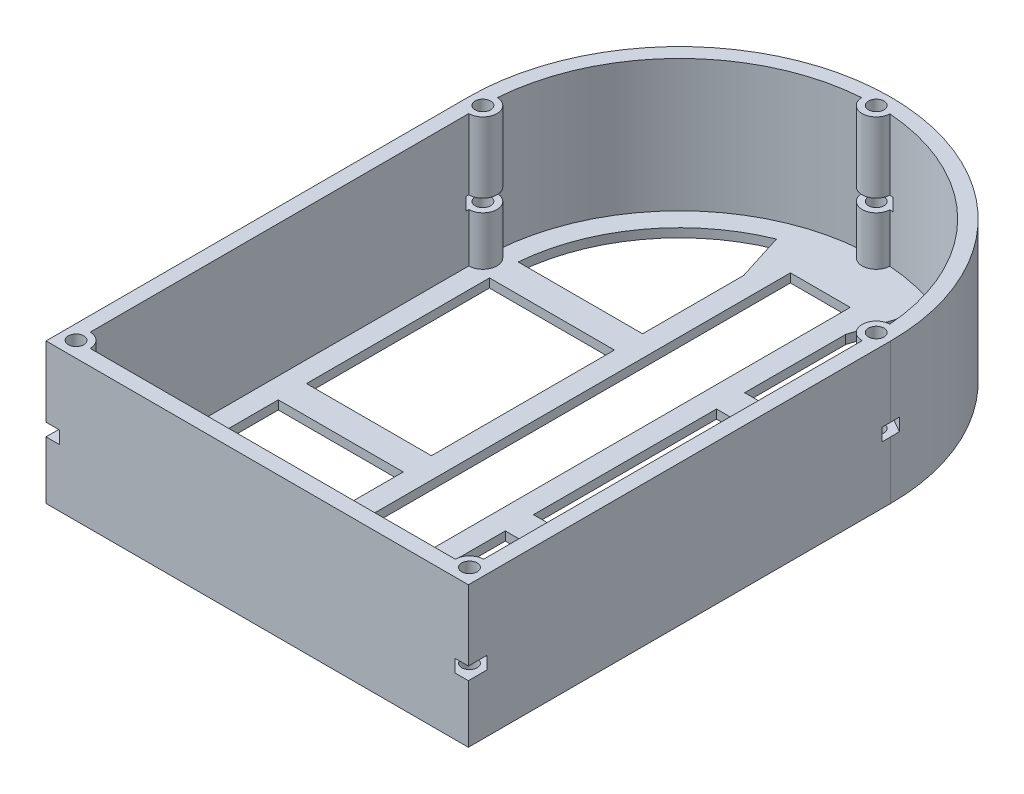
from build123d import *

# Parameters (mm, degrees)
SKETCH1_R           = 1.1
BOSS_EXTRUDE1_DEPTH = 20
BOSS_EXTRUDE2_START = -1.25
SKETCH2_W           = 8.5
SKETCH2_H           = 70
SKETCH2_W_2         = 17.75
SKETCH2_H_2         = 26
BOSS_EXTRUDE2_DEPTH = 1.25
CUT_EXTRUDE1_START  = -10
CUT_EXTRUDE1_DEPTH  = 1.8


with BuildPart() as part:
    # Sketch1 → Boss-Extrude1 (new body)
    with BuildSketch(Plane(origin=(0, 0, 0), x_dir=(1, 0, 0), z_dir=(0, 1, 0))):
        with BuildLine():
            ThreePointArc((30, 0), (0, 30), (-30, 0))
            Line((-30, 0), (-30, -60))
            Line((-30, -60), (30, -60))
            Line((30, -60), (30, 0))
        make_face()
        with Locations((-27.94, -57.785)):
            Circle(SKETCH1_R, mode=Mode.SUBTRACT)
        with Locations((27.94, -57.785)):
            Circle(SKETCH1_R, mode=Mode.SUBTRACT)
        with Locations((-27.94, 0)):
            Circle(SKETCH1_R, mode=Mode.SUBTRACT)
        with BuildLine():
            Line((27.94, -2), (27.94, -55.785))
            ThreePointArc((27.94, -55.785), (26.525786438, -56.370786438), (25.94, -57.785))
            Line((25.94, -57.785), (-25.94, -57.785))
            ThreePointArc((-25.94, -57.785), (-26.525786438, -56.370786438), (-27.94, -55.785))
            Line((-27.94, -55.785), (-27.94, -2))
            ThreePointArc((-27.94, -2), (-25.940320377, -0.035796715), (-27.868418039, 1.998718595))
            ThreePointArc((-27.868418039, 1.998718595), (-19.756563466, 19.756563466), (-1.998718595, 27.868418039))
            ThreePointArc((-1.998718595, 27.868418039), (0, 25.94), (1.998718595, 27.868418039))
            ThreePointArc((1.998718595, 27.868418039), (19.756563466, 19.756563466), (27.868418039, 1.998718595))
            ThreePointArc((27.868418039, 1.998718595), (25.940320377, -0.035796715), (27.94, -2))
        make_face(mode=Mode.SUBTRACT)
        with Locations((0, 27.94)):
            Circle(SKETCH1_R, mode=Mode.SUBTRACT)
        with Locations((27.94, 0)):
            Circle(SKETCH1_R, mode=Mode.SUBTRACT)
    extrude(amount=-BOSS_EXTRUDE1_DEPTH)

    # Sketch2 → Boss-Extrude2 (add)
    with BuildSketch(Plane.XZ.offset(20).offset(BOSS_EXTRUDE2_START)):
        with BuildLine():
            Line((30, 0), (30, 60))
            Line((30, 60), (-30, 60))
            Line((-30, 60), (-30, 0))
            ThreePointArc((-30, 0), (0, -30), (30, 0))
        make_face()
        Polygon((-7.25, 53), (-7.25, 32), (-25, 32), (-25, 55), (-7.25, 55), align=None, mode=Mode.SUBTRACT)
        with Locations((0, 15)):
            Rectangle(SKETCH2_W, SKETCH2_H, mode=Mode.SUBTRACT)
        Polygon((7.25, 53), (7.25, 32), (25, 32), (25, 55), (7.25, 55), align=None, mode=Mode.SUBTRACT)
        with Locations((16.125, 15)):
            Rectangle(SKETCH2_W_2, SKETCH2_H_2, mode=Mode.SUBTRACT)
        with BuildLine():
            Line((-7.25, -16.347418764), (-9.399268665, -23.165788322))
            ThreePointArc((-9.399268665, -23.165788322), (-20.160567843, -14.783487553), (-24.919871589, -2))
            Line((-24.919871589, -2), (-7.25, -2))
            Line((-7.25, -2), (-7.25, -16.347418764))
        make_face(mode=Mode.SUBTRACT)
        with BuildLine():
            Line((7.25, -16.347418764), (9.399268665, -23.165788322))
            ThreePointArc((9.399268665, -23.165788322), (20.160567843, -14.783487553), (24.919871589, -2))
            Line((24.919871589, -2), (7.25, -2))
            Line((7.25, -2), (7.25, -16.347418764))
        make_face(mode=Mode.SUBTRACT)
        with Locations((-16.125, 15)):
            Rectangle(SKETCH2_W_2, SKETCH2_H_2, mode=Mode.SUBTRACT)
    extrude(amount=BOSS_EXTRUDE2_DEPTH)

    # Sketch3 → Cut-Extrude1 (cut)
    with BuildSketch(Plane(origin=(0, 0, 0), x_dir=(1, 0, 0), z_dir=(0, 1, 0)).offset(CUT_EXTRUDE1_START)):
        Polygon((2.424871131, 27.94), (1.212435565, 30.04), (-1.212435565, 30.04), (-2.424871131, 27.94), (-2.923440006, 27.076453377), (-1.212435565, 25.84), (1.212435565, 25.84), (2.664841123, 27.524359781), align=None)
        Polygon((27.94, -2.424871131), (30.04, -1.212435565), (30.04, 1.212435565), (27.94, 2.424871131), (27.29756517, 2.795781052), (25.84, 1.212435565), (25.84, -1.212435565), align=None)
        Polygon((30.28224565, -58.412602831), (29.65464282, -56.07035718), (27.312397169, -55.44275435), (25.59775435, -57.157397169), (26.22535718, -59.49964282), (28.567602831, -60.12724565), (30.909848481, -60.754848481), align=None)
        Polygon((-25.59775435, -57.157397169), (-27.312397169, -55.44275435), (-29.65464282, -56.07035718), (-30.28224565, -58.412602831), (-30.909848481, -60.754848481), (-28.567602831, -60.12724565), (-26.22535718, -59.49964282), align=None)
        Polygon((-30.04, 1.212435565), (-30.04, -1.212435565), (-27.94, -2.424871131), (-25.84, -1.212435565), (-25.84, 1.212435565), (-27.443113573, 2.711748643), (-27.94, 2.424871131), align=None)
    extrude(amount=-CUT_EXTRUDE1_DEPTH, mode=Mode.SUBTRACT)


solid = part.part
